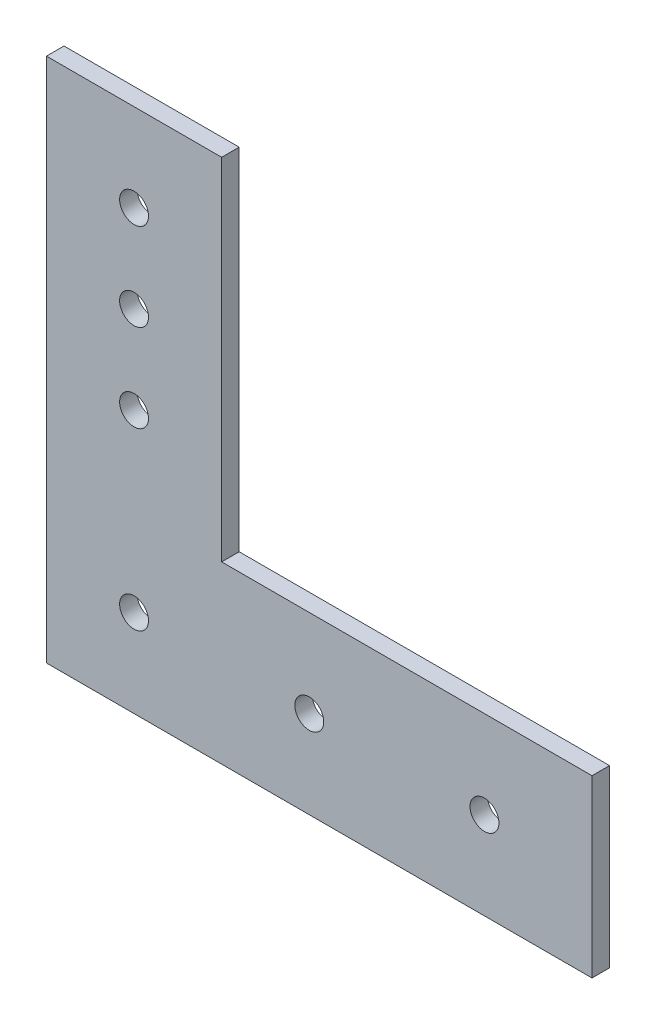
from build123d import *

# Parameters (mm, degrees)
SKETCH_1_R      = 1.65
EXTRUDE_1_DEPTH = 2


with BuildPart() as part:
    # 草图1 → 凸台-拉伸1 (new body)
    with BuildSketch(Plane.XY):
        Polygon((10, 10), (52.276412277, 10), (52.276412277, -10), (-10, -10), (-10, 10), (-10, 50), (10, 50), align=None)
        with Locations((20, 0)):
            Circle(SKETCH_1_R, mode=Mode.SUBTRACT)
        with Locations((3.0503e-05, 20)):
            Circle(SKETCH_1_R, mode=Mode.SUBTRACT)
        with Locations((3.0503e-05, 40)):
            Circle(SKETCH_1_R, mode=Mode.SUBTRACT)
        with Locations((3.0503e-05, 30)):
            Circle(SKETCH_1_R, mode=Mode.SUBTRACT)
        Circle(SKETCH_1_R, mode=Mode.SUBTRACT)
        with Locations((40, 0)):
            Circle(SKETCH_1_R, mode=Mode.SUBTRACT)
    extrude(amount=EXTRUDE_1_DEPTH)


solid = part.part
